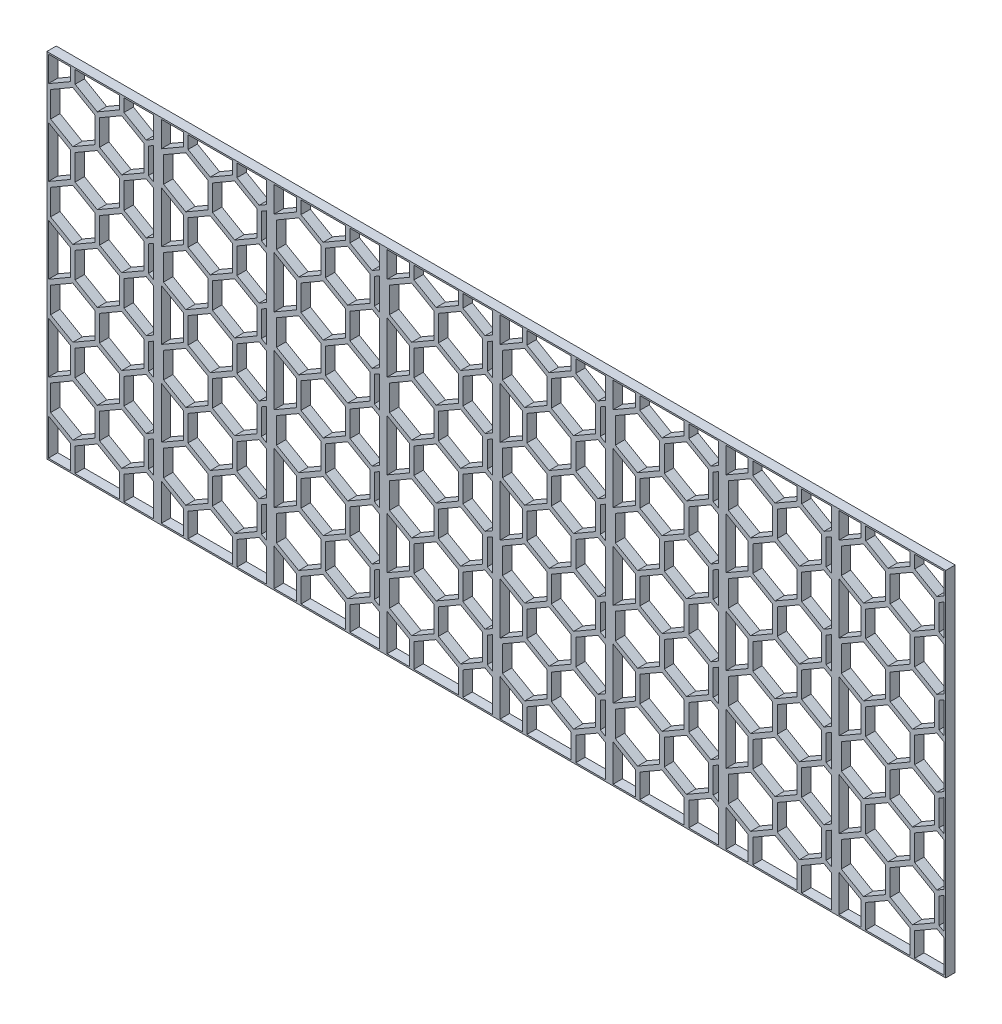
from build123d import *

# Parameters (mm, degrees)
BOSS_EXTRUDE1_DEPTH = 6.35
SKETCH2_W           = 76.2
SKETCH2_H           = 238.125
SKETCH2_W_2         = 70.993
SKETCH2_H_2         = 236.093
BOSS_EXTRUDE3_DEPTH = 6.35
LPATTERN1_COUNT     = 8
LPATTERN1_PITCH     = 76.2
SKETCH5_W           = 6.35
SKETCH5_H           = 238.125
CUT_EXTRUDE1_DEPTH  = 1.5875
SKETCH6_W           = 6.35
SKETCH6_H           = 238.125
CUT_EXTRUDE2_DEPTH  = 1.5875


# Read off the part's stored shape, not the designer's step: Boss-Extrude1
with BuildPart() as part:
    # Boss-Extrude1 outline → Boss-Extrude1 (new body)
    with BuildSketch(Plane.XY):
        Polygon((67.53271446, 216.152969127), (70.993, 218.150765915), (70.993, 221.710889406), (65.991135768, 218.823061746), (51.034930518, 227.458030873), (51.034930518, 236.093), (47.951773134, 236.093), (47.951773134, 227.458030873), (32.995567884, 218.823061746), (18.039362634, 227.458030873), (18.039362634, 236.093), (14.95620525, 236.093), (14.95620525, 227.458030873), (0, 218.823061746), (0, 196.212938254), (14.95620525, 187.577969127), (14.95620525, 170.308030873), (0, 161.673061746), (0, 139.062938254), (14.95620525, 130.427969127), (14.95620525, 113.158030873), (0, 104.523061746), (0, 81.912938254), (14.95620525, 73.277969127), (14.95620525, 56.008030873), (0, 47.373061746), (0, 24.762938254), (14.95620525, 16.127969127), (14.95620525, 0), (18.039362634, 0), (18.039362634, 16.127969127), (32.995567884, 24.762938254), (47.951773134, 16.127969127), (47.951773134, 0), (51.034930518, 0), (51.034930518, 16.127969127), (65.991135768, 24.762938254), (70.993, 21.875110594), (70.993, 25.435234085), (67.53271446, 27.433030873), (67.53271446, 44.702969127), (70.993, 46.700765915), (70.993, 50.260889406), (65.991135768, 47.373061746), (51.034930518, 56.008030873), (51.034930518, 73.277969127), (65.991135768, 81.912938254), (70.993, 79.025110594), (70.993, 82.585234085), (67.53271446, 84.583030873), (67.53271446, 101.852969127), (70.993, 103.850765915), (70.993, 107.410889406), (65.991135768, 104.523061746), (51.034930518, 113.158030873), (51.034930518, 130.427969127), (65.991135768, 139.062938254), (70.993, 136.175110594), (70.993, 139.735234085), (67.53271446, 141.733030873), (67.53271446, 159.002969127), (70.993, 161.000765915), (70.993, 164.560889406), (65.991135768, 161.673061746), (51.034930518, 170.308030873), (51.034930518, 187.577969127), (65.991135768, 196.212938254), (70.993, 193.325110594), (70.993, 196.885234085), (67.53271446, 198.883030873), align=None)
        Polygon((16.497783942, 53.337938254), (31.453989192, 44.702969127), (31.453989192, 27.433030873), (16.497783942, 18.798061746), (1.541578692, 27.433030873), (1.541578692, 44.702969127), align=None, mode=Mode.SUBTRACT)
        Polygon((16.497783942, 110.487938254), (31.453989192, 101.852969127), (31.453989192, 84.583030873), (16.497783942, 75.948061746), (1.541578692, 84.583030873), (1.541578692, 101.852969127), align=None, mode=Mode.SUBTRACT)
        Polygon((32.995567884, 81.912938254), (47.951773134, 73.277969127), (47.951773134, 56.008030873), (32.995567884, 47.373061746), (18.039362634, 56.008030873), (18.039362634, 73.277969127), align=None, mode=Mode.SUBTRACT)
        Polygon((49.493351826, 53.337938254), (64.449557076, 44.702969127), (64.449557076, 27.433030873), (49.493351826, 18.798061746), (34.537146576, 27.433030873), (34.537146576, 44.702969127), align=None, mode=Mode.SUBTRACT)
        Polygon((49.493351826, 110.487938254), (64.449557076, 101.852969127), (64.449557076, 84.583030873), (49.493351826, 75.948061746), (34.537146576, 84.583030873), (34.537146576, 101.852969127), align=None, mode=Mode.SUBTRACT)
        Polygon((16.497783942, 167.637938254), (31.453989192, 159.002969127), (31.453989192, 141.733030873), (16.497783942, 133.098061746), (1.541578692, 141.733030873), (1.541578692, 159.002969127), align=None, mode=Mode.SUBTRACT)
        Polygon((32.995567884, 139.062938254), (47.951773134, 130.427969127), (47.951773134, 113.158030873), (32.995567884, 104.523061746), (18.039362634, 113.158030873), (18.039362634, 130.427969127), align=None, mode=Mode.SUBTRACT)
        Polygon((16.497783942, 224.787938254), (31.453989192, 216.152969127), (31.453989192, 198.883030873), (16.497783942, 190.248061746), (1.541578692, 198.883030873), (1.541578692, 216.152969127), align=None, mode=Mode.SUBTRACT)
        Polygon((32.995567884, 196.212938254), (47.951773134, 187.577969127), (47.951773134, 170.308030873), (32.995567884, 161.673061746), (18.039362634, 170.308030873), (18.039362634, 187.577969127), align=None, mode=Mode.SUBTRACT)
        Polygon((49.493351826, 167.637938254), (64.449557076, 159.002969127), (64.449557076, 141.733030873), (49.493351826, 133.098061746), (34.537146576, 141.733030873), (34.537146576, 159.002969127), align=None, mode=Mode.SUBTRACT)
        Polygon((49.493351826, 224.787938254), (64.449557076, 216.152969127), (64.449557076, 198.883030873), (49.493351826, 190.248061746), (34.537146576, 198.883030873), (34.537146576, 216.152969127), align=None, mode=Mode.SUBTRACT)
    extrude(amount=BOSS_EXTRUDE1_DEPTH)

    # Sketch2 → Boss-Extrude3 (add)
    with BuildSketch(Plane.XY):
        with Locations((35.4965, 118.0465)):
            Rectangle(SKETCH2_W, SKETCH2_H)
        with Locations((35.4965, 118.0465)):
            Rectangle(SKETCH2_W_2, SKETCH2_H_2, mode=Mode.SUBTRACT)
    extrude(amount=BOSS_EXTRUDE3_DEPTH)


with BuildPart() as lpattern1_1:
    # LPattern1: pattern copy
    add(part.part.moved(Location(Vector(1, 0, 0) * (1 * LPATTERN1_PITCH))))


with BuildPart() as lpattern1_2:
    # LPattern1: pattern copy
    add(part.part.moved(Location(Vector(1, 0, 0) * (2 * LPATTERN1_PITCH))))


with BuildPart() as lpattern1_3:
    # LPattern1: pattern copy
    add(part.part.moved(Location(Vector(1, 0, 0) * (3 * LPATTERN1_PITCH))))


with BuildPart() as lpattern1_4:
    # LPattern1: pattern copy
    add(part.part.moved(Location(Vector(1, 0, 0) * (4 * LPATTERN1_PITCH))))


with BuildPart() as lpattern1_5:
    # LPattern1: pattern copy
    add(part.part.moved(Location(Vector(1, 0, 0) * (5 * LPATTERN1_PITCH))))


with BuildPart() as lpattern1_6:
    # LPattern1: pattern copy
    add(part.part.moved(Location(Vector(1, 0, 0) * (6 * LPATTERN1_PITCH))))


with BuildPart() as lpattern1_7:
    # LPattern1: pattern copy
    add(part.part.moved(Location(Vector(1, 0, 0) * (7 * LPATTERN1_PITCH))))

    # Sketch6 → Cut-Extrude2 (cut)
    with BuildSketch(Plane(origin=(606.9965, 0, 0), x_dir=(0, 0, -1), z_dir=(1, 0, 0))):
        with Locations((-3.175, 118.0465)):
            Rectangle(SKETCH6_W, SKETCH6_H)
    extrude(amount=-CUT_EXTRUDE2_DEPTH, mode=Mode.SUBTRACT)


with BuildPart() as part_1:
    add(part.part)

    # Sketch5 → Cut-Extrude1 (cut)
    with BuildSketch(Plane.ZY.offset(2.6035)):
        with Locations((3.175, 118.0465)):
            Rectangle(SKETCH5_W, SKETCH5_H)
    extrude(amount=-CUT_EXTRUDE1_DEPTH, mode=Mode.SUBTRACT)


with BuildPart() as lpattern1_5_1:
    add(lpattern1_5.part)

    # Combine1: union LPattern1_7, LPattern1_2, LPattern1_4, LPattern1_6, LPattern1_1, part, LPattern1_3
    add(lpattern1_7.part)
    add(lpattern1_2.part)
    add(lpattern1_4.part)
    add(lpattern1_6.part)
    add(lpattern1_1.part)
    add(part_1.part)
    add(lpattern1_3.part)


solid = lpattern1_5_1.part
